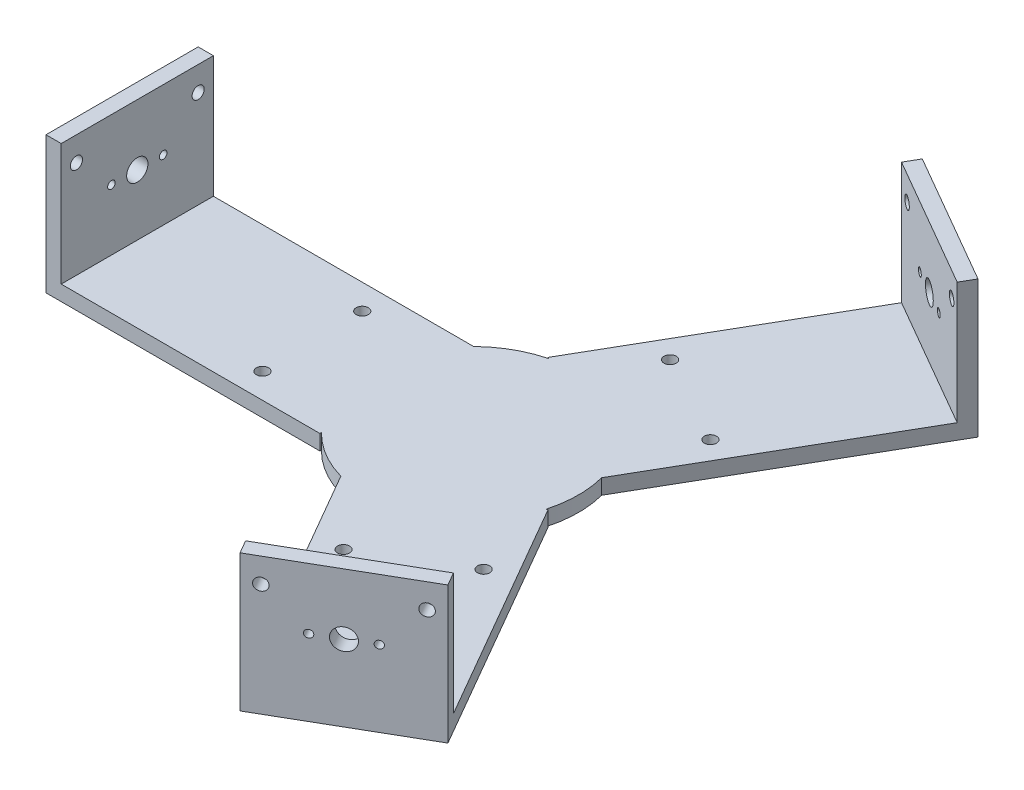
from build123d import *

# Parameters (mm, degrees)
BOSS_EXTRU_3_DEPTH      = 5
ESQUISSE4_W             = 5
ESQUISSE4_H             = 50
BOSS_EXTRU_4_DEPTH      = 40
ESQUISSE5_R             = 3.5
ESQUISSE5_R_2           = 1.25
ENL_V_MAT_EXTRU_1_DEPTH = 225.427684996
ESQUISSE6_R             = 3.5
ESQUISSE6_R_2           = 1.25
ENL_V_MAT_EXTRU_2_DEPTH = 272.884889055
ESQUISSE7_R             = 3.5
ESQUISSE7_R_2           = 1.25
ENL_V_MAT_EXTRU_3_DEPTH = 272.884889055
ESQUISSE8_R             = 2
ENL_V_MAT_EXTRU_4_DEPTH = 166.498710073
ESQUISSE9_R             = 2
ENL_V_MAT_EXTRU_5_DEPTH = 229.657587111
ESQUISSE10_R            = 2
ENL_V_MAT_EXTRU_6_DEPTH = 277.752861
ENL_V_MAT_EXTRU_7_REACH = 278.753
ESQUISSE11_R            = 2


with BuildPart() as part:
    # Esquisse3 → Boss.-Extru.3 (new body)
    with BuildSketch(Plane(origin=(0, 0, 0), x_dir=(1, 0, 0), z_dir=(0, 1, 0))):
        with BuildLine():
            Line((-115, -25), (-25, -25))
            Line((-25, -25), (-24.99494949, -24.500051021))
            ThreePointArc((-24.99494949, -24.500051021), (-17.805293657, -30.132565736), (-9.403186381, -33.713203436))
            Line((-9.403186381, -33.713203436), (35.849364905, -112.092921435))
            Line((35.849364905, -112.092921435), (79.150635095, -87.092921435))
            Line((79.150635095, -87.092921435), (34.150635095, -9.150635095))
            Line((34.150635095, -9.150635095), (33.715141323, -9.396235714))
            ThreePointArc((33.715141323, -9.396235714), (34.998214236, -0.353553761), (33.898083809, 8.713203436))
            Line((33.898083809, 8.713203436), (79.150635095, 87.092921435))
            Line((79.150635095, 87.092921435), (35.849364905, 112.092921435))
            Line((35.849364905, 112.092921435), (-9.150635095, 34.150635095))
            Line((-9.150635095, 34.150635095), (-8.720191833, 33.896286735))
            ThreePointArc((-8.720191833, 33.896286735), (-17.19292058, 30.486119496), (-24.494897428, 25))
            Line((-24.494897428, 25), (-115, 25))
            Line((-115, 25), (-115, -25))
        make_face()
    extrude(amount=BOSS_EXTRU_3_DEPTH)

    # Esquisse4 → Boss.-Extru.4 (add)
    with BuildSketch(Plane(origin=(0, 5, 0), x_dir=(1, 0, 0), z_dir=(0, 1, 0))):
        with Locations((-112.5, 0)):
            Rectangle(ESQUISSE4_W, ESQUISSE4_H)
        Polygon((35.849364905, 112.092921435), (79.150635095, 87.092921435), (76.650635095, 82.762794416), (33.349364905, 107.762794416), align=None)
        Polygon((79.150635095, -87.092921435), (76.650635095, -82.762794416), (33.349364905, -107.762794416), (35.849364905, -112.092921435), align=None)
    extrude(amount=BOSS_EXTRU_4_DEPTH)

    # Esquisse5 → Enlèv. mat.-Extru.1 (cut, through all)
    with BuildSketch(Plane(origin=(-110, 0, 0), x_dir=(0, 0, -1), z_dir=(1, 0, 0))):
        with Locations((0, 25)):
            Circle(ESQUISSE5_R)
        with Locations((-8.5, 25)):
            Circle(ESQUISSE5_R_2)
        with Locations((8.5, 25)):
            Circle(ESQUISSE5_R_2)
    extrude(amount=-ENL_V_MAT_EXTRU_1_DEPTH, mode=Mode.SUBTRACT)

    # Esquisse6 → Enlèv. mat.-Extru.2 (cut, through all)
    with BuildSketch(Plane(origin=(55, 0, 95.262794416), x_dir=(-0.8660254037844386, 0, 0.4999999999999999), z_dir=(-0.49999999999999994, 0, -0.8660254037844387))):
        with Locations((0, 25)):
            Circle(ESQUISSE6_R)
        with Locations((-8.5, 25)):
            Circle(ESQUISSE6_R_2)
        with Locations((8.5, 25)):
            Circle(ESQUISSE6_R_2)
    extrude(amount=-ENL_V_MAT_EXTRU_2_DEPTH, mode=Mode.SUBTRACT)

    # Esquisse7 → Enlèv. mat.-Extru.3 (cut, through all)
    with BuildSketch(Plane(origin=(55, 0, -95.262794416), x_dir=(0.8660254037844388, 0, 0.49999999999999983), z_dir=(-0.4999999999999998, 0, 0.8660254037844387))):
        with Locations((0, 25)):
            Circle(ESQUISSE7_R)
        with Locations((8.5, 25)):
            Circle(ESQUISSE7_R_2)
        with Locations((-8.5, 25)):
            Circle(ESQUISSE7_R_2)
    extrude(amount=-ENL_V_MAT_EXTRU_3_DEPTH, mode=Mode.SUBTRACT)

    # Esquisse8 → Enlèv. mat.-Extru.4 (cut, through all)
    with BuildSketch(Plane(origin=(0, 5, 0), x_dir=(1, 0, 0), z_dir=(0, 1, 0))):
        with Locations((11.915763974, -54.138708614)):
            Circle(ESQUISSE8_R)
        with Locations((40.568493854, -36.766692542)):
            Circle(ESQUISSE8_R)
        with Locations((11.556642828, 53.516692542)):
            Circle(ESQUISSE8_R)
        with Locations((40.927615001, 37.388708614)):
            Circle(ESQUISSE8_R)
        with Locations((-52.125136682, -16.75)):
            Circle(ESQUISSE8_R)
        with Locations((-52.843378975, 16.75)):
            Circle(ESQUISSE8_R)
    extrude(amount=-ENL_V_MAT_EXTRU_4_DEPTH, mode=Mode.SUBTRACT)

    # Esquisse9 → Enlèv. mat.-Extru.5 (cut, through all)
    with BuildSketch(Plane.ZY.offset(115)):
        with Locations((-20, 37)):
            Circle(ESQUISSE9_R)
        with Locations((20, 37)):
            Circle(ESQUISSE9_R)
    extrude(amount=-ENL_V_MAT_EXTRU_5_DEPTH, mode=Mode.SUBTRACT)

    # Esquisse10 → Enlèv. mat.-Extru.6 (cut, through all)
    with BuildSketch(Plane(origin=(57.5, 0, -99.592921435), x_dir=(-0.8660254037844388, 0, -0.49999999999999983), z_dir=(0.4999999999999998, 0, -0.8660254037844387))):
        with Locations((-20, 37)):
            Circle(ESQUISSE10_R)
        with Locations((20, 37)):
            Circle(ESQUISSE10_R)
    extrude(amount=-ENL_V_MAT_EXTRU_6_DEPTH, mode=Mode.SUBTRACT)

    # Esquisse11 → Enlèv. mat.-Extru.7 (cut, up to next)
    with BuildSketch(Plane(origin=(57.5, 0, 99.592921435), x_dir=(0.8660254037844384, 0, -0.5000000000000006), z_dir=(0.5000000000000006, 0, 0.8660254037844384)), mode=Mode.PRIVATE) as enl_v_mat_extru_7_sk1:
        with Locations((20, 37)):
            Circle(ESQUISSE11_R)
    enl_v_mat_extru_7_tool1 = extrude(enl_v_mat_extru_7_sk1.sketch, amount=-ENL_V_MAT_EXTRU_7_REACH, mode=Mode.PRIVATE) & part.part
    # Esquisse11 → Enlèv. mat.-Extru.7 (cut, up to next)
    with BuildSketch(Plane(origin=(57.5, 0, 99.592921435), x_dir=(0.8660254037844384, 0, -0.5000000000000006), z_dir=(0.5000000000000006, 0, 0.8660254037844384)), mode=Mode.PRIVATE) as enl_v_mat_extru_7_sk2:
        with Locations((-20, 37)):
            Circle(ESQUISSE11_R)
    enl_v_mat_extru_7_tool2 = extrude(enl_v_mat_extru_7_sk2.sketch, amount=-ENL_V_MAT_EXTRU_7_REACH, mode=Mode.PRIVATE) & part.part
    add(enl_v_mat_extru_7_tool1.solids().sort_by_distance((74.820508, 37, 89.592921))[0], mode=Mode.SUBTRACT)
    add(enl_v_mat_extru_7_tool2.solids().sort_by_distance((40.179492, 37, 109.592921))[0], mode=Mode.SUBTRACT)


solid = part.part
